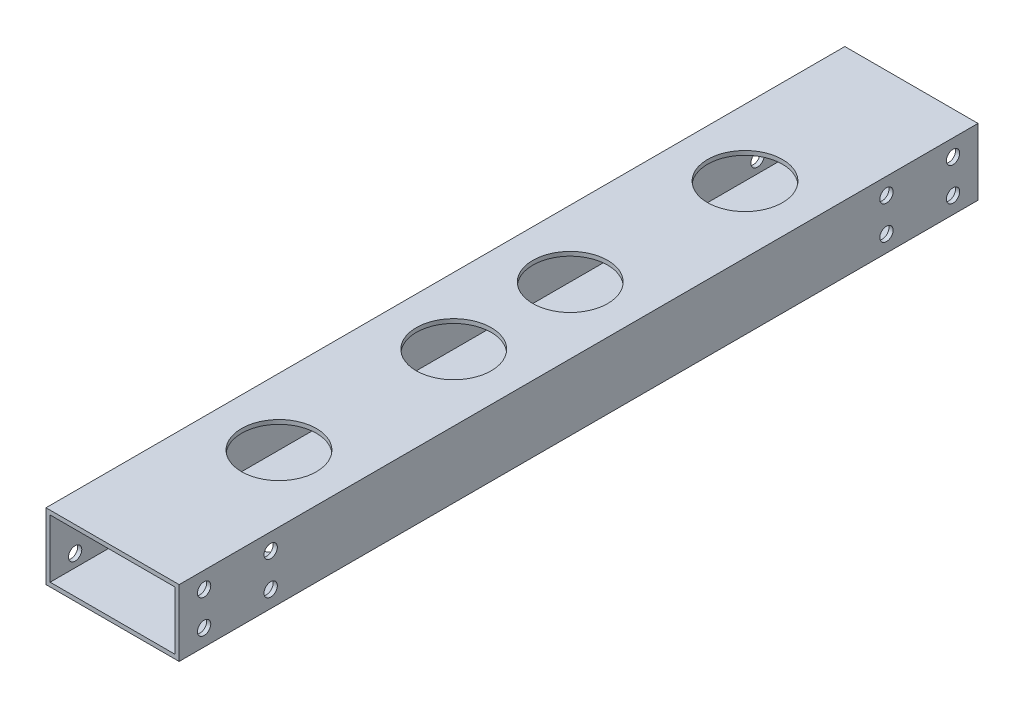
from build123d import *

# Parameters (mm, degrees)
SKETCH2_W               = 50.8
SKETCH2_H               = 25.4
SKETCH2_W_2             = 47.625
SKETCH2_H_2             = 22.225
BOSS_EXTRUDE1_DEPTH     = 152.4
SKETCH3_R               = 14.2875
CUT_EXTRUDE1_DEPTH      = 157.576115675
CUT_EXTRUDE2_DEPTH      = 162.144934764
CUT_EXTRUDE2_DEPTH_BACK = 162.144934764
SKETCH4_R               = 2.54


with BuildPart() as part:
    # Sketch2 → Boss-Extrude1 (new, symmetric)
    with BuildSketch(Plane.XY):
        Rectangle(SKETCH2_W, SKETCH2_H)
        Rectangle(SKETCH2_W_2, SKETCH2_H_2, mode=Mode.SUBTRACT)
    extrude(amount=BOSS_EXTRUDE1_DEPTH, both=True)

    # Sketch3 → Cut-Extrude1 (cut, through all)
    with BuildSketch(Plane(origin=(0, 12.7, 0), x_dir=(1, 0, 0), z_dir=(0, 1, 0))):
        with Locations((0, -88.9)):
            Circle(SKETCH3_R)
        with Locations((0, -22.225)):
            Circle(SKETCH3_R)
        with Locations((0, 22.225)):
            Circle(SKETCH3_R)
        with Locations((0, 88.9)):
            Circle(SKETCH3_R)
    extrude(amount=-CUT_EXTRUDE1_DEPTH, mode=Mode.SUBTRACT)

    # Sketch4 → Cut-Extrude2 (cut, two sides: drawn at the far end of the back side and taken through both)
    with BuildSketch(Plane.ZY.offset(25.4).offset(-CUT_EXTRUDE2_DEPTH_BACK)):
        with Locations((-142.875, 6.35)):
            Circle(SKETCH4_R)
        with Locations((-142.875, -6.35)):
            Circle(SKETCH4_R)
        with Locations((-117.475, 6.35)):
            Circle(SKETCH4_R)
        with Locations((-117.475, -6.35)):
            Circle(SKETCH4_R)
        with Locations((117.475, -6.35)):
            Circle(SKETCH4_R)
        with Locations((117.475, 6.35)):
            Circle(SKETCH4_R)
        with Locations((142.875, -6.35)):
            Circle(SKETCH4_R)
        with Locations((142.875, 6.35)):
            Circle(SKETCH4_R)
    extrude(amount=CUT_EXTRUDE2_DEPTH + CUT_EXTRUDE2_DEPTH_BACK, mode=Mode.SUBTRACT)


solid = part.part
